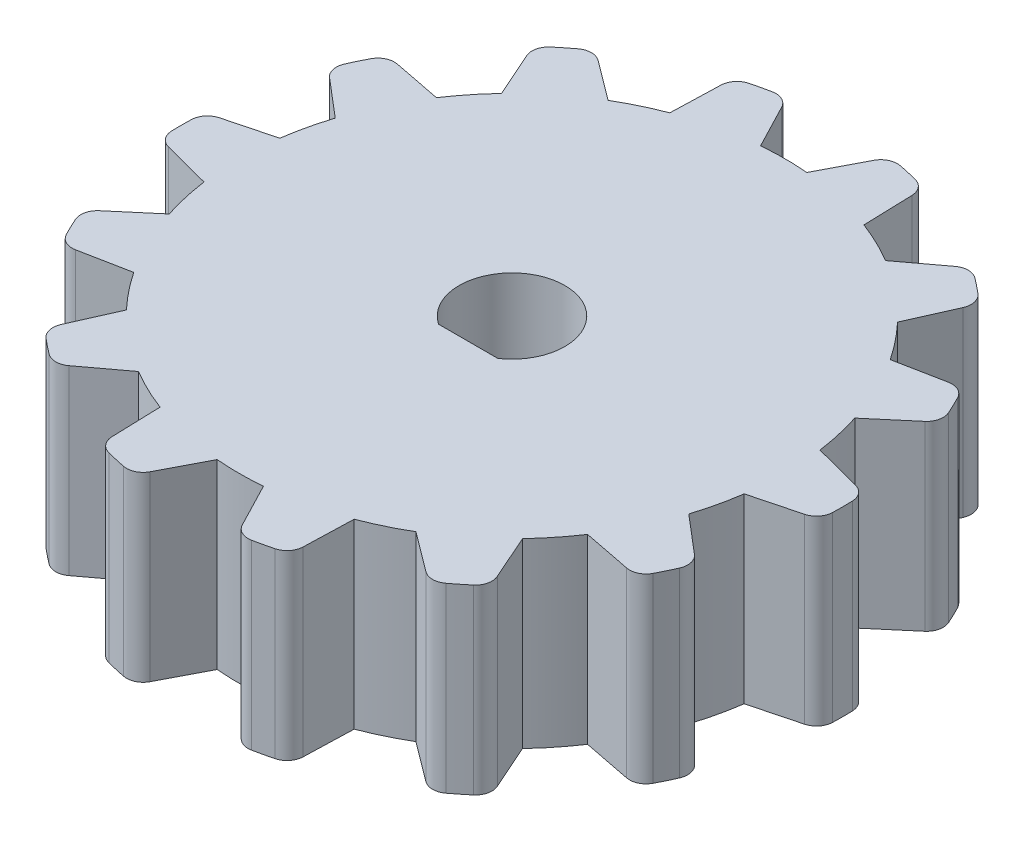
from build123d import *

# Parameters (mm, degrees)
SKETCH1_R                = 20
BOSS_EXTRUDE1_DEPTH      = 11
CUT_EXTRUDE1_REACH       = 32.348
FILLET1_R                = 1
CIRPATTERN1_COUNT        = 14
FILLET1_OF_CIRPATTERN1_R = 1
CUT_EXTRUDE2_REACH       = 32.113


with BuildPart() as part:
    # Sketch1 → Boss-Extrude1 (new body)
    with BuildSketch(Plane(origin=(0, 0, 0), x_dir=(1, 0, 0), z_dir=(0, 1, 0))):
        Circle(SKETCH1_R)
    extrude(amount=BOSS_EXTRUDE1_DEPTH)

    # Sketch2 → Cut-Extrude1 (cut, up to next)
    with BuildSketch(Plane(origin=(0, 11, 0), x_dir=(1, 0, 0), z_dir=(0, 1, 0)), mode=Mode.PRIVATE) as cut_extrude1_sk1:
        with BuildLine():
            Line((-3.125, 19.754350787), (-1.399921321, 16.440505476))
            ThreePointArc((-1.399921321, 16.440505476), (0, 16.5), (1.399921321, 16.440505476))
            Line((1.399921321, 16.440505476), (3.125, 19.754350787))
            ThreePointArc((3.125, 19.754350787), (0, 20), (-3.125, 19.754350787))
        make_face()
    cut_extrude1_tool1 = extrude(cut_extrude1_sk1.sketch, amount=-CUT_EXTRUDE1_REACH, mode=Mode.PRIVATE) & part.part
    cut_extrude1 = cut_extrude1_tool1.solids().sort_by_distance((0, 11, -18.420369))[0]
    add(cut_extrude1, mode=Mode.SUBTRACT)

    # Fillet1
    fillet1_edges = [part.edges().sort_by_distance(p)[0] for p in [
        (3.125, 5.5, -19.754350787),
        (-3.125, 5.5, -19.754350787),
    ]]
    fillet(fillet1_edges, radius=FILLET1_R)

    # CirPattern1: Cut-Extrude1 ×14 about axis
    cirpattern1_axis = Axis((0, 11, 0), (0, -1, 0))
    for i in range(1, CIRPATTERN1_COUNT):
        add(cut_extrude1.rotate(cirpattern1_axis, i * 360 / CIRPATTERN1_COUNT), mode=Mode.SUBTRACT)

    # Fillet1 of CirPattern1
    fillet1_of_cirpattern1_edges = [part.edges().sort_by_distance(p)[0] for p in [
        (11.386619295, 5.5, -16.44216838),
        (5.755563871, 5.5, -19.153941749),
        (17.392978991, 5.5, -9.873412875),
        (13.49616773, 5.5, -14.75985964),
        (19.954445887, 5.5, -1.349106861),
        (18.56369005, 5.5, -7.442406312),
        (18.56369005, 5.5, 7.442406312),
        (19.954445887, 5.5, 1.349106861),
        (13.49616773, 5.5, 14.75985964),
        (17.392978991, 5.5, 9.873412875),
        (5.755563871, 5.5, 19.153941749),
        (11.386619295, 5.5, 16.44216838),
        (-3.125, 5.5, 19.754350787),
        (3.125, 5.5, 19.754350787),
        (-11.386619295, 5.5, 16.44216838),
        (-5.755563871, 5.5, 19.153941749),
        (-17.392978991, 5.5, 9.873412875),
        (-13.49616773, 5.5, 14.75985964),
        (-19.954445887, 5.5, 1.349106861),
        (-18.56369005, 5.5, 7.442406312),
        (-18.56369005, 5.5, -7.442406312),
        (-19.954445887, 5.5, -1.349106861),
        (-13.49616773, 5.5, -14.75985964),
        (-17.392978991, 5.5, -9.873412875),
        (-5.755563871, 5.5, -19.153941749),
        (-11.386619295, 5.5, -16.44216838),
    ]]
    fillet(fillet1_of_cirpattern1_edges, radius=FILLET1_OF_CIRPATTERN1_R)

    # Sketch3 → Cut-Extrude2 (cut, up to next)
    with BuildSketch(Plane(origin=(0, 11, 0), x_dir=(1, 0, 0), z_dir=(0, 1, 0)), mode=Mode.PRIVATE) as cut_extrude2_sk1:
        with BuildLine():
            Line((1.793739111, -2.65), (-1.793739111, -2.65))
            ThreePointArc((-1.793739111, -2.65), (0, 3.2), (1.793739111, -2.65))
        make_face()
    cut_extrude2_tool1 = extrude(cut_extrude2_sk1.sketch, amount=-CUT_EXTRUDE2_REACH, mode=Mode.PRIVATE) & part.part
    add(cut_extrude2_tool1.solids().sort_by_distance((0, 11, -0.124799))[0], mode=Mode.SUBTRACT)


solid = part.part
